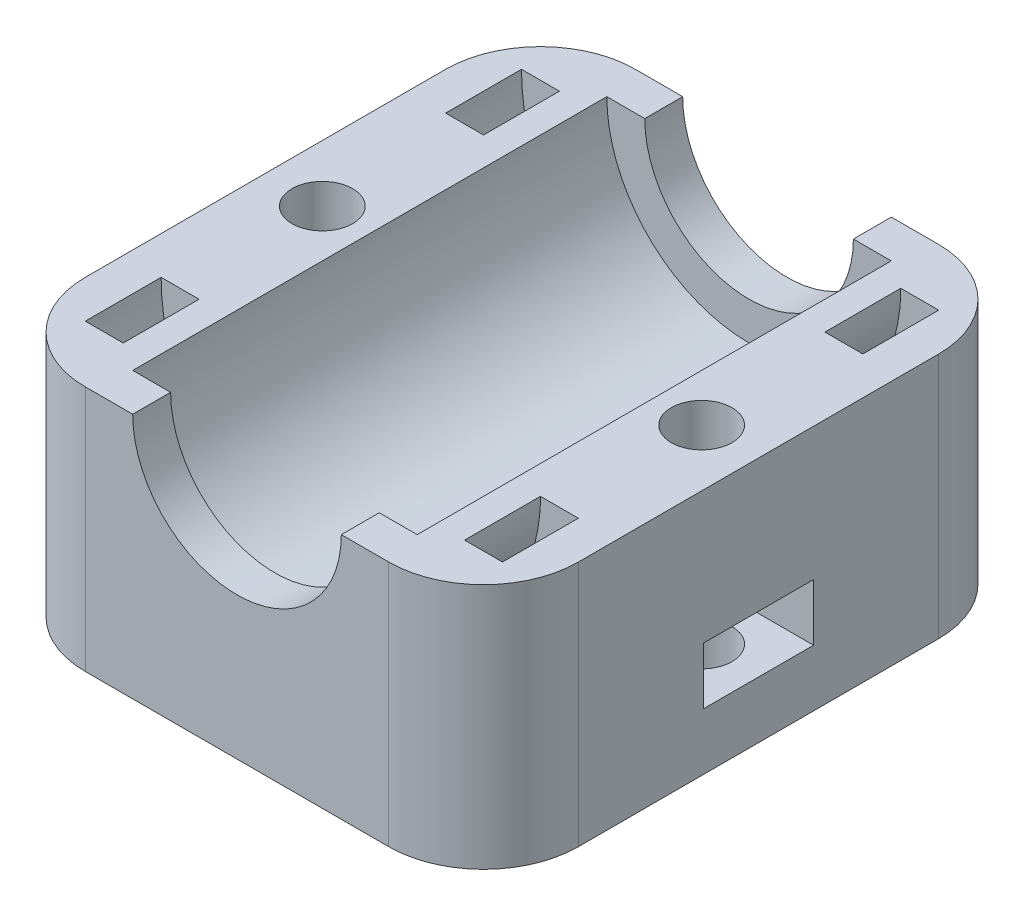
from build123d import *

# Parameters (mm, degrees)
ESBO_O1_W                  = 26
ESBO_O1_H                  = 13
RESSALTO_EXTRUS_O1_DEPTH   = 29
CORTE_EXTRUS_O1_DEPTH      = 33.438403167
CORTE_EXTRUS_O1_DEPTH_BACK = 33.438403167
ESBO_O2_R                  = 5.5
ESBO_O3_R                  = 7.5
CORTE_EXTRUS_O2_DEPTH      = 25
CORTE_EXTRUS_O3_DEPTH      = 35.336569427
CORTE_EXTRUS_O3_DEPTH_BACK = 35.336569427
ESBO_O4_R                  = 1.6
CORTE_EXTRUS_O4_DEPTH      = 3
ESBO_O9_W                  = 8
ESBO_O9_H                  = 4
CORTE_EXTRUS_O5_DEPTH      = 3
FILETE1_R                  = 5


with BuildPart() as part:
    # Esboço1 → Ressalto-extrusão1 (new body)
    with BuildSketch(Plane.XY):
        Rectangle(ESBO_O1_W, ESBO_O1_H)
    extrude(amount=RESSALTO_EXTRUS_O1_DEPTH)

    # Esboço2 → Corte-extrusão1 (cut, two sides: drawn at the far end of the back side and taken through both)
    with BuildSketch(Plane.XY.offset(29).offset(-CORTE_EXTRUS_O1_DEPTH_BACK)):
        with Locations((0, 6.5)):
            Circle(ESBO_O2_R)
    extrude(amount=CORTE_EXTRUS_O1_DEPTH + CORTE_EXTRUS_O1_DEPTH_BACK, mode=Mode.SUBTRACT)

    # Esboço3 → Corte-extrusão2 (cut)
    with BuildSketch(Plane.XY.offset(27)):
        with Locations((0, 6.5)):
            Circle(ESBO_O3_R)
    extrude(amount=-CORTE_EXTRUS_O2_DEPTH, mode=Mode.SUBTRACT)

    # Esboço4 → Corte-extrusão3 (cut, two sides: drawn at the far end of the back side and taken through both)
    with BuildSketch(Plane(origin=(0, 6.5, 0), x_dir=(1, 0, 0), z_dir=(0, 1, 0)).offset(-CORTE_EXTRUS_O3_DEPTH_BACK)):
        with Locations(Location((-10, -14.5, 0), (0, 0, 270))):
            Circle(ESBO_O4_R)
        with Locations(Location((10, -14.5, 0), (0, 0, 270))):
            Circle(ESBO_O4_R)
    extrude(amount=CORTE_EXTRUS_O3_DEPTH + CORTE_EXTRUS_O3_DEPTH_BACK, mode=Mode.SUBTRACT)

    # Varredura de corte3: read off the stored shape, not the designer's step
    # Varredura de corte3: loft between two sections, ruled curve by curve
    varredura_de_corte3_from = [
        Edge.make_bspline([(-10.775531387, 11.14102753, 3), (-10.815047893, 10.387007675, 3), (-10.859579119, 9.537232339, 3), (-10.942482774, 7.955474229, 3), (-11.000003483, 7.230191203, 3), (-10.999993175, 5.06927711, 3), (-10.717078713, 3.385508213, 3), (-9.067866438, -0.006108266, 3), (-7.679635371, -1.685716419, 3), (-4.830903728, -3.44525385, 3), (-3.774716833, -3.895333549, 3), (-1.552511027, -4.449938605, 3), (-0.403453822, -4.550209028, 3), (2.969944564, -4.328615808, 3), (5.023571546, -3.476580102, 3), (8.13506471, -1.154366891, 3), (9.189674801, 0.267167465, 3), (10.533085234, 2.985384839, 3), (10.837160801, 4.285623822, 3), (11.004780041, 6.01871971, 3), (11.006990461, 6.575860832, 3), (10.96949773, 7.517101654, 3), (10.943022714, 7.945129378, 3), (10.873144208, 9.27841043, 3), (10.824758408, 10.201720017, 3), (10.775531387, 11.14102753, 3)], [0, 0, 0, 0, 0.056576928, 0.056576928, 0.113153857, 0.113153857, 0.224009625, 0.224009625, 0.334865393, 0.334865393, 0.390293276, 0.390293276, 0.44572116, 0.44572116, 0.556576928, 0.556576928, 0.667432696, 0.667432696, 0.778288464, 0.778288464, 0.833716348, 0.833716348, 0.889144232, 0.889144232, 1, 1, 1, 1], 3),
        Edge.make_bspline([(-8.778272317, 11.036355618, 3), (-8.818366558, 10.271311923, 3), (-8.86155068, 9.447238277, 3), (-8.945993073, 7.836124466, 3), (-9.000002401, 7.107268908, 3), (-8.999995296, 5.310128738, 3), (-8.764237068, 3.942975251, 3), (-7.423445328, 1.185624705, 3), (-6.27357029, -0.203437636, 3), (-3.957441466, -1.63400923, 3), (-3.084493861, -2.006248941, 3), (-1.274147115, -2.45806464, 3), (-0.32387933, -2.540671478, 3), (2.417516141, -2.360593842, 3), (4.119219834, -1.655921663, 3), (6.646937102, 0.230601396, 3), (7.51801706, 1.398774697, 3), (8.618786605, 3.626040825, 3), (8.867342653, 4.694186327, 3), (9.003623581, 6.103250891, 3), (9.006690622, 6.5435831, 3), (8.972969022, 7.390126226, 3), (8.946060492, 7.834793966, 3), (8.875291444, 9.185065517, 3), (8.82794518, 10.088540932, 3), (8.778272317, 11.036355618, 3)], [0, 0, 0, 0, 0.056576928, 0.056576928, 0.113153857, 0.113153857, 0.224009625, 0.224009625, 0.334865393, 0.334865393, 0.390293276, 0.390293276, 0.44572116, 0.44572116, 0.556576928, 0.556576928, 0.667432696, 0.667432696, 0.778288464, 0.778288464, 0.833716348, 0.833716348, 0.889144232, 0.889144232, 1, 1, 1, 1], 3),
        Edge.make_line((-8.778272317, 11.036355618, 3), (-10.775531387, 11.14102753, 3)),
        Edge.make_line((8.778272317, 11.036355618, 3), (10.775531387, 11.14102753, 3)),
    ]
    varredura_de_corte3_to = [
        Edge.make_bspline([(-10.775531387, 11.14102753, 7), (-10.815047893, 10.387007675, 7), (-10.859579119, 9.537232339, 7), (-10.942482774, 7.955474229, 7), (-11.000003483, 7.230191203, 7), (-10.999993175, 5.06927711, 7), (-10.717078713, 3.385508213, 7), (-9.067866438, -0.006108266, 7), (-7.679635371, -1.685716419, 7), (-4.830903728, -3.44525385, 7), (-3.774716833, -3.895333549, 7), (-1.552511027, -4.449938605, 7), (-0.403453822, -4.550209028, 7), (2.969944564, -4.328615808, 7), (5.023571546, -3.476580102, 7), (8.13506471, -1.154366891, 7), (9.189674801, 0.267167465, 7), (10.533085234, 2.985384839, 7), (10.837160801, 4.285623822, 7), (11.004780041, 6.01871971, 7), (11.006990461, 6.575860832, 7), (10.96949773, 7.517101654, 7), (10.943022714, 7.945129378, 7), (10.873144208, 9.27841043, 7), (10.824758408, 10.201720017, 7), (10.775531387, 11.14102753, 7)], [0, 0, 0, 0, 0.056576928, 0.056576928, 0.113153857, 0.113153857, 0.224009625, 0.224009625, 0.334865393, 0.334865393, 0.390293276, 0.390293276, 0.44572116, 0.44572116, 0.556576928, 0.556576928, 0.667432696, 0.667432696, 0.778288464, 0.778288464, 0.833716348, 0.833716348, 0.889144232, 0.889144232, 1, 1, 1, 1], 3),
        Edge.make_bspline([(-8.778272317, 11.036355618, 7), (-8.818366558, 10.271311923, 7), (-8.86155068, 9.447238277, 7), (-8.945993073, 7.836124466, 7), (-9.000002401, 7.107268908, 7), (-8.999995296, 5.310128738, 7), (-8.764237068, 3.942975251, 7), (-7.423445328, 1.185624705, 7), (-6.27357029, -0.203437636, 7), (-3.957441466, -1.63400923, 7), (-3.084493861, -2.006248941, 7), (-1.274147115, -2.45806464, 7), (-0.32387933, -2.540671478, 7), (2.417516141, -2.360593842, 7), (4.119219834, -1.655921663, 7), (6.646937102, 0.230601396, 7), (7.51801706, 1.398774697, 7), (8.618786605, 3.626040825, 7), (8.867342653, 4.694186327, 7), (9.003623581, 6.103250891, 7), (9.006690622, 6.5435831, 7), (8.972969022, 7.390126226, 7), (8.946060492, 7.834793966, 7), (8.875291444, 9.185065517, 7), (8.82794518, 10.088540932, 7), (8.778272317, 11.036355618, 7)], [0, 0, 0, 0, 0.056576928, 0.056576928, 0.113153857, 0.113153857, 0.224009625, 0.224009625, 0.334865393, 0.334865393, 0.390293276, 0.390293276, 0.44572116, 0.44572116, 0.556576928, 0.556576928, 0.667432696, 0.667432696, 0.778288464, 0.778288464, 0.833716348, 0.833716348, 0.889144232, 0.889144232, 1, 1, 1, 1], 3),
        Edge.make_line((-8.778272317, 11.036355618, 7), (-10.775531387, 11.14102753, 7)),
        Edge.make_line((8.778272317, 11.036355618, 7), (10.775531387, 11.14102753, 7)),
    ]
    varredura_de_corte3 = Solid(Shell([*[Face.make_surface_from_curves(varredura_de_corte3_from[k], varredura_de_corte3_to[k]) for k in range(4)], Face(Wire(varredura_de_corte3_from)), Face(Wire(varredura_de_corte3_to))]))
    add(varredura_de_corte3, mode=Mode.SUBTRACT)

    # Varredura de corte3 2: loft between two sections, ruled curve by curve
    varredura_de_corte3_2_from = [
        Edge.make_bspline([(-10.775531387, 11.14102753, 22), (-10.815050253, 10.386962648, 22), (-10.859635544, 9.536156226, 22), (-10.942604964, 7.953142141, 22), (-11.000003387, 7.227604876, 22), (-10.999993448, 5.09243912, 22), (-10.726075216, 3.44374676, 22), (-9.146415207, 0.117814577, 22), (-7.826638231, -1.531050563, 22), (-4.171497206, -3.909251659, 22), (-1.912358031, -4.556779213, 22), (2.517456834, -4.434897746, 22), (4.570919991, -3.689422793, 22), (7.764052722, -1.527285148, 22), (8.887440792, -0.158899703, 22), (10.364225069, 2.511206921, 22), (10.732123337, 3.816518914, 22), (10.975605623, 5.5614094, 22), (11.004902153, 6.119453759, 22), (10.993656399, 7.13678057, 22), (10.963259766, 7.559009248, 22), (10.895302463, 8.855554069, 22), (10.847393897, 9.769809145, 22), (10.799382035, 10.685930053, 22)], [0, 0, 0, 0, 0.057220999, 0.057220999, 0.114441998, 0.114441998, 0.225136749, 0.225136749, 0.335831499, 0.335831499, 0.446526249, 0.446526249, 0.557220999, 0.557220999, 0.667915749, 0.667915749, 0.7786105, 0.7786105, 0.833957875, 0.833957875, 0.88930525, 0.88930525, 1, 1, 1, 1], 3),
        Edge.make_bspline([(-8.778272317, 11.036355618, 22), (-8.818364203, 10.271356871, 22), (-8.861613386, 9.446042366, 22), (-8.946108983, 7.833912176, 22), (-9.000002332, 7.104831646, 22), (-8.999995488, 5.329945493, 22), (-8.772011309, 3.991285732, 22), (-7.487299037, 1.286355363, 22), (-6.385007619, -0.082964565, 22), (-3.431648648, -2.004555434, 22), (-1.541287594, -2.5458131, 22), (2.036368433, -2.447377138, 22), (3.749427608, -1.830311698, 22), (6.342822793, -0.074267526, 22), (7.271131746, 1.051066146, 22), (8.480231231, 3.237185214, 22), (8.780527991, 4.302274211, 22), (8.980191062, 5.733137414, 22), (9.004131059, 6.178194136, 22), (8.994672137, 7.033801275, 22), (8.966591972, 7.443057915, 22), (8.896860843, 8.773440999, 22), (8.851022767, 9.64819435, 22), (8.802122965, 10.58125814, 22)], [0, 0, 0, 0, 0.057220999, 0.057220999, 0.114441998, 0.114441998, 0.225136749, 0.225136749, 0.335831499, 0.335831499, 0.446526249, 0.446526249, 0.557220999, 0.557220999, 0.667915749, 0.667915749, 0.7786105, 0.7786105, 0.833957875, 0.833957875, 0.88930525, 0.88930525, 1, 1, 1, 1], 3),
        Edge.make_line((-8.778272317, 11.036355618, 22), (-10.775531387, 11.14102753, 22)),
        Edge.make_line((8.802122965, 10.58125814, 22), (10.799382035, 10.685930053, 22)),
    ]
    varredura_de_corte3_2_to = [
        Edge.make_bspline([(-10.775531387, 11.14102753, 26), (-10.815050253, 10.386962648, 26), (-10.859635544, 9.536156226, 26), (-10.942604964, 7.953142141, 26), (-11.000003387, 7.227604876, 26), (-10.999993448, 5.09243912, 26), (-10.726075216, 3.44374676, 26), (-9.146415207, 0.117814577, 26), (-7.826638231, -1.531050563, 26), (-4.171497206, -3.909251659, 26), (-1.912358031, -4.556779213, 26), (2.517456834, -4.434897746, 26), (4.570919991, -3.689422793, 26), (7.764052722, -1.527285148, 26), (8.887440792, -0.158899703, 26), (10.364225069, 2.511206921, 26), (10.732123337, 3.816518914, 26), (10.975605623, 5.5614094, 26), (11.004902153, 6.119453759, 26), (10.993656399, 7.13678057, 26), (10.963259766, 7.559009248, 26), (10.895302463, 8.855554069, 26), (10.847393897, 9.769809145, 26), (10.799382035, 10.685930053, 26)], [0, 0, 0, 0, 0.057220999, 0.057220999, 0.114441998, 0.114441998, 0.225136749, 0.225136749, 0.335831499, 0.335831499, 0.446526249, 0.446526249, 0.557220999, 0.557220999, 0.667915749, 0.667915749, 0.7786105, 0.7786105, 0.833957875, 0.833957875, 0.88930525, 0.88930525, 1, 1, 1, 1], 3),
        Edge.make_bspline([(-8.778272317, 11.036355618, 26), (-8.818364203, 10.271356871, 26), (-8.861613386, 9.446042366, 26), (-8.946108983, 7.833912176, 26), (-9.000002332, 7.104831646, 26), (-8.999995488, 5.329945493, 26), (-8.772011309, 3.991285732, 26), (-7.487299037, 1.286355363, 26), (-6.385007619, -0.082964565, 26), (-3.431648648, -2.004555434, 26), (-1.541287594, -2.5458131, 26), (2.036368433, -2.447377138, 26), (3.749427608, -1.830311698, 26), (6.342822793, -0.074267526, 26), (7.271131746, 1.051066146, 26), (8.480231231, 3.237185214, 26), (8.780527991, 4.302274211, 26), (8.980191062, 5.733137414, 26), (9.004131059, 6.178194136, 26), (8.994672137, 7.033801275, 26), (8.966591972, 7.443057915, 26), (8.896860843, 8.773440999, 26), (8.851022767, 9.64819435, 26), (8.802122965, 10.58125814, 26)], [0, 0, 0, 0, 0.057220999, 0.057220999, 0.114441998, 0.114441998, 0.225136749, 0.225136749, 0.335831499, 0.335831499, 0.446526249, 0.446526249, 0.557220999, 0.557220999, 0.667915749, 0.667915749, 0.7786105, 0.7786105, 0.833957875, 0.833957875, 0.88930525, 0.88930525, 1, 1, 1, 1], 3),
        Edge.make_line((-8.778272317, 11.036355618, 26), (-10.775531387, 11.14102753, 26)),
        Edge.make_line((8.802122965, 10.58125814, 26), (10.799382035, 10.685930053, 26)),
    ]
    varredura_de_corte3_2 = Solid(Shell([*[Face.make_surface_from_curves(varredura_de_corte3_2_from[k], varredura_de_corte3_2_to[k]) for k in range(4)], Face(Wire(varredura_de_corte3_2_from)), Face(Wire(varredura_de_corte3_2_to))]))
    add(varredura_de_corte3_2, mode=Mode.SUBTRACT)

    # Esboço8 → Corte-extrusão4 (cut)
    with BuildSketch(Plane(origin=(0, -3.5, 0), x_dir=(-1, 0, 0), z_dir=(0, -1, 0))):
        Polygon((-11.674315781, -11.6), (-15.702583778, -11.6), (-15.702583778, -17.4), (-11.674315781, -17.4), (-8.325684219, -17.4), (-6.651368439, -14.5), (-8.325684219, -11.6), align=None)
        Polygon((11.674315781, -11.6), (8.325684219, -11.6), (6.651368439, -14.5), (8.325684219, -17.4), (11.674315781, -17.4), (15.292356459, -17.4), (15.292356459, -11.6), align=None)
    extrude(amount=-CORTE_EXTRUS_O4_DEPTH, mode=Mode.SUBTRACT)

    # Esboço9 → Corte-extrusão5 (cut)
    with BuildSketch(Plane.XZ.offset(6.5)):
        with Locations((0, 24)):
            Rectangle(ESBO_O9_W, ESBO_O9_H)
        with Locations((0, 5)):
            Rectangle(ESBO_O9_W, ESBO_O9_H)
    extrude(amount=-CORTE_EXTRUS_O5_DEPTH, mode=Mode.SUBTRACT)

    # Filete1
    filete1_edges = [part.edges().sort_by_distance(p)[0] for p in [
        (-13, 0, 29),
        (13, 0, 29),
        (-13, 0, 0),
        (13, 0, 0),
    ]]
    fillet(filete1_edges, radius=FILETE1_R)


solid = part.part
